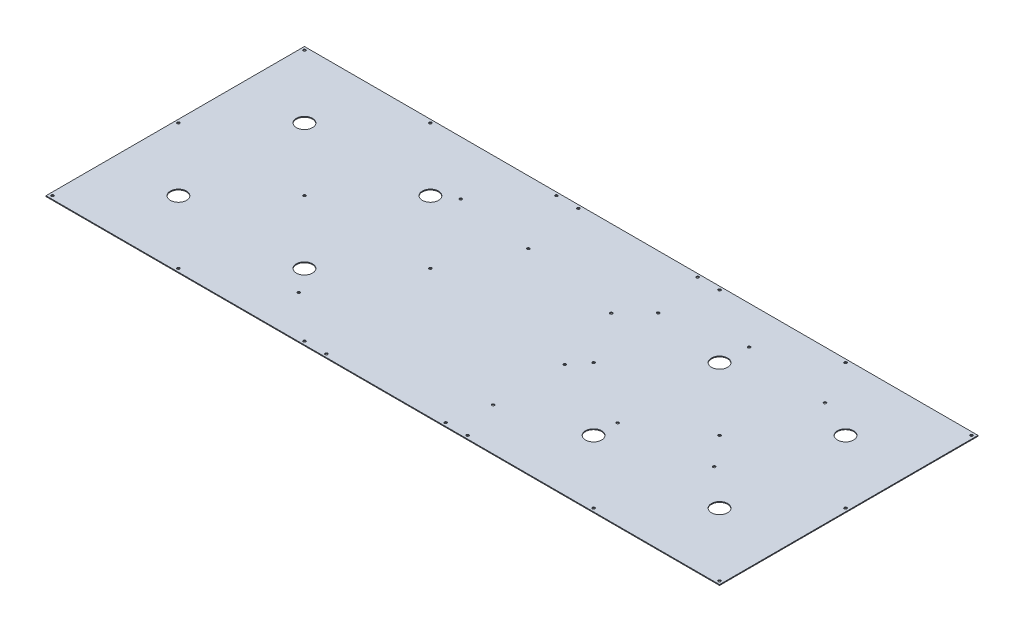
from build123d import *

# Parameters (mm, degrees)
MAIN_PLATE_W        = 834
MAIN_PLATE_H        = 320
BOSS_EXTRUDE1_DEPTH = 1.016
MAIN_HOLES_R        = 1.6
CUT_EXTRUDE1_DEPTH  = 447.64307031
SMA_R               = 10
CUT_EXTRUDE2_DEPTH  = 447.64307031
SKETCH3_R           = 1.6
CUT_EXTRUDE3_DEPTH  = 447.64307031


with BuildPart() as part:
    # main_plate → Boss-Extrude1 (new body)
    with BuildSketch(Plane(origin=(0, 0, 0), x_dir=(1, 0, 0), z_dir=(0, 1, 0))):
        Rectangle(MAIN_PLATE_W, MAIN_PLATE_H)
    extrude(amount=BOSS_EXTRUDE1_DEPTH)

    # main_holes → Cut-Extrude1 (cut, through all)
    with BuildSketch(Plane(origin=(0, 1.016, 0), x_dir=(1, 0, 0), z_dir=(0, 1, 0))):
        with Locations((-413, 156)):
            Circle(MAIN_HOLES_R)
        with Locations((-257, 156)):
            Circle(MAIN_HOLES_R)
        with Locations((-101, 156)):
            Circle(MAIN_HOLES_R)
        with Locations((-257, 0)):
            Circle(MAIN_HOLES_R)
        with Locations((-101, 0)):
            Circle(MAIN_HOLES_R)
        with Locations((-257, -156)):
            Circle(MAIN_HOLES_R)
        with Locations((-101, -156)):
            Circle(MAIN_HOLES_R)
        with Locations((-413, 0)):
            Circle(MAIN_HOLES_R)
        with Locations((-413, -156)):
            Circle(MAIN_HOLES_R)
        with Locations((413, -156)):
            Circle(MAIN_HOLES_R)
        with Locations((413, 0)):
            Circle(MAIN_HOLES_R)
        with Locations((101, -156)):
            Circle(MAIN_HOLES_R)
        with Locations((257, -156)):
            Circle(MAIN_HOLES_R)
        with Locations((101, 0)):
            Circle(MAIN_HOLES_R)
        with Locations((257, 0)):
            Circle(MAIN_HOLES_R)
        with Locations((101, 156)):
            Circle(MAIN_HOLES_R)
        with Locations((257, 156)):
            Circle(MAIN_HOLES_R)
        with Locations((413, 156)):
            Circle(MAIN_HOLES_R)
        with Locations((-73.81875, 156)):
            Circle(MAIN_HOLES_R)
        with Locations((73.81875, 156)):
            Circle(MAIN_HOLES_R)
        with Locations((73.81875, -156)):
            Circle(MAIN_HOLES_R)
        with Locations((-73.81875, -156)):
            Circle(MAIN_HOLES_R)
    extrude(amount=-CUT_EXTRUDE1_DEPTH, mode=Mode.SUBTRACT)

    # sma → Cut-Extrude2 (cut, through all)
    with BuildSketch(Plane(origin=(0, 1.016, 0), x_dir=(1, 0, 0), z_dir=(0, 1, 0))):
        with Locations((-335, 78)):
            Circle(SMA_R)
        with Locations((-179, 78)):
            Circle(SMA_R)
        with Locations((-179, -78)):
            Circle(SMA_R)
        with Locations((-335, -78)):
            Circle(SMA_R)
        with Locations((335, 78)):
            Circle(SMA_R)
        with Locations((179, 78)):
            Circle(SMA_R)
        with Locations((335, -78)):
            Circle(SMA_R)
        with Locations((179, -78)):
            Circle(SMA_R)
    extrude(amount=-CUT_EXTRUDE2_DEPTH, mode=Mode.SUBTRACT)

    # Sketch3 → Cut-Extrude3 (cut, through all)
    with BuildSketch(Plane(origin=(0, 1.016, 0), x_dir=(1, 0, 0), z_dir=(0, 1, 0))):
        with Locations((180.624415858, 112.936757464)):
            Circle(SKETCH3_R)
        with Locations((287.304415858, 100.179523877)):
            Circle(SKETCH3_R)
        with Locations((287.230832177, -36.980456385)):
            Circle(SKETCH3_R)
        with Locations((180.53720557, -49.623219142)):
            Circle(SKETCH3_R)
        with Locations((-156.795231329, 93.209451678)):
            Circle(SKETCH3_R)
        with Locations((-156.805231329, -107.450548322)):
            Circle(SKETCH3_R)
        with Locations((85.304768671, -19.820548322)):
            Circle(SKETCH3_R)
        with Locations((84.03720557, -107.450548322)):
            Circle(SKETCH3_R)
        with Locations((58.924768671, 63.919451678)):
            Circle(SKETCH3_R)
        with Locations((87.674768671, 93.209451678)):
            Circle(SKETCH3_R)
        with Locations((-61.545231329, 81.819451678)):
            Circle(SKETCH3_R)
    extrude(amount=-CUT_EXTRUDE3_DEPTH, mode=Mode.SUBTRACT)


solid = part.part
